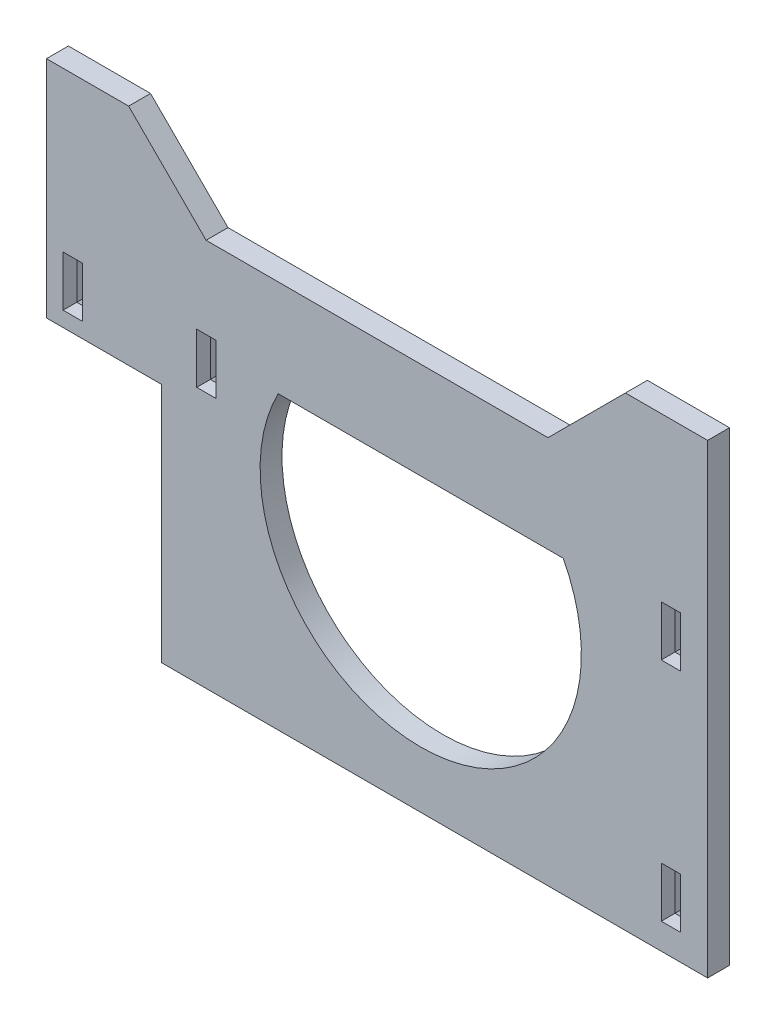
from build123d import *
from OCP.BRepFilletAPI import BRepFilletAPI_MakeChamfer

# Parameters (mm, degrees)
SKETCH1_W           = 3.53
SKETCH1_H           = 9.2
BOSS_EXTRUDE1_DEPTH = 4
BOSS_EXTRUDE2_DEPTH = 4
CHAMFER1_SIZE       = 1.5
CHAMFER1_SIZE2      = 0.5


with BuildPart() as part:
    # Sketch1 → Boss-Extrude1 (new body)
    with BuildSketch(Plane.XY):
        Polygon((52.4925, 30), (52.4925, -30), (-47.2075, -30), (-47.2075, 14), (-68.2075, 14), (-68.2075, 30), align=None)
        with BuildLine():
            Line((-25.900000003, 23.179137901), (26.135555553, 23.179137901))
            ThreePointArc((26.135555553, 23.179137901), (0.117777775, -19.676914391), (-25.900000003, 23.179137901))
        make_face(mode=Mode.SUBTRACT)
        with Locations((-39.0075, 21.35)):
            Rectangle(SKETCH1_W, SKETCH1_H, mode=Mode.SUBTRACT)
        with Locations((45.7925, 20.65)):
            Rectangle(SKETCH1_W, SKETCH1_H, mode=Mode.SUBTRACT)
        with Locations((45.8, -20.65)):
            Rectangle(SKETCH1_W, SKETCH1_H, mode=Mode.SUBTRACT)
        with Locations((-63.4075, 21.35)):
            Rectangle(SKETCH1_W, SKETCH1_H, mode=Mode.SUBTRACT)
    extrude(amount=BOSS_EXTRUDE1_DEPTH)

    # Sketch2 → Boss-Extrude2 (add)
    with BuildSketch(Plane.XY):
        Polygon((-68.2075, 30), (52.4925, 30), (52.4925, 55), (37.4925, 55), (23.350364376, 40.857864376), (-39.065364376, 40.857864376), (-53.2075, 55), (-68.2075, 55), align=None)
    extrude(amount=BOSS_EXTRUDE2_DEPTH)

    # Chamfer1: one chamfer whose edges measure the first distance from different faces: ONE call of the kernel's chamfer builder (chamfer() names one face for all edges)
    chamfer1_edges_1 = [part.edges().sort_by_distance(p)[0] for p in [
        (45.8, -25.25, 0),
    ]]
    chamfer1_side_1 = [part.faces().sort_by_distance(p)[0] for p in [
        (45.8, -25.25, 2),
    ]]
    chamfer1_edges_2 = [part.edges().sort_by_distance(p)[0] for p in [
        (44.035, -20.65, 0),
    ]]
    chamfer1_side_2 = [part.faces().sort_by_distance(p)[0] for p in [
        (44.035, -20.65, 2),
    ]]
    chamfer1_edges_3 = [part.edges().sort_by_distance(p)[0] for p in [
        (45.8, -16.05, 0),
    ]]
    chamfer1_side_3 = [part.faces().sort_by_distance(p)[0] for p in [
        (45.8, -16.05, 2),
    ]]
    chamfer1_edges_4 = [part.edges().sort_by_distance(p)[0] for p in [
        (47.565, -20.65, 0),
    ]]
    chamfer1_side_4 = [part.faces().sort_by_distance(p)[0] for p in [
        (47.565, -20.65, 2),
    ]]
    chamfer1_edges_5 = [part.edges().sort_by_distance(p)[0] for p in [
        (-63.4075, 25.95, 0),
    ]]
    chamfer1_side_5 = [part.faces().sort_by_distance(p)[0] for p in [
        (-63.4075, 25.95, 2),
    ]]
    chamfer1_edges_6 = [part.edges().sort_by_distance(p)[0] for p in [
        (-61.6425, 21.35, 0),
    ]]
    chamfer1_side_6 = [part.faces().sort_by_distance(p)[0] for p in [
        (-61.6425, 21.35, 2),
    ]]
    chamfer1_edges_7 = [part.edges().sort_by_distance(p)[0] for p in [
        (-63.4075, 16.75, 0),
    ]]
    chamfer1_side_7 = [part.faces().sort_by_distance(p)[0] for p in [
        (-63.4075, 16.75, 2),
    ]]
    chamfer1_edges_8 = [part.edges().sort_by_distance(p)[0] for p in [
        (-65.1725, 21.35, 0),
    ]]
    chamfer1_side_8 = [part.faces().sort_by_distance(p)[0] for p in [
        (-65.1725, 21.35, 2),
    ]]
    chamfer1_edges_9 = [part.edges().sort_by_distance(p)[0] for p in [
        (-39.0075, 25.95, 0),
    ]]
    chamfer1_side_9 = [part.faces().sort_by_distance(p)[0] for p in [
        (-39.0075, 25.95, 2),
    ]]
    chamfer1_edges_10 = [part.edges().sort_by_distance(p)[0] for p in [
        (-37.2425, 21.35, 0),
    ]]
    chamfer1_side_10 = [part.faces().sort_by_distance(p)[0] for p in [
        (-37.2425, 21.35, 2),
    ]]
    chamfer1_edges_11 = [part.edges().sort_by_distance(p)[0] for p in [
        (-39.0075, 16.75, 0),
    ]]
    chamfer1_side_11 = [part.faces().sort_by_distance(p)[0] for p in [
        (-39.0075, 16.75, 2),
    ]]
    chamfer1_edges_12 = [part.edges().sort_by_distance(p)[0] for p in [
        (-40.7725, 21.35, 0),
    ]]
    chamfer1_side_12 = [part.faces().sort_by_distance(p)[0] for p in [
        (-40.7725, 21.35, 2),
    ]]
    chamfer1_edges_13 = [part.edges().sort_by_distance(p)[0] for p in [
        (45.7925, 25.25, 0),
    ]]
    chamfer1_side_13 = [part.faces().sort_by_distance(p)[0] for p in [
        (45.7925, 25.25, 2),
    ]]
    chamfer1_edges_14 = [part.edges().sort_by_distance(p)[0] for p in [
        (47.5575, 20.65, 0),
    ]]
    chamfer1_side_14 = [part.faces().sort_by_distance(p)[0] for p in [
        (47.5575, 20.65, 2),
    ]]
    chamfer1_edges_15 = [part.edges().sort_by_distance(p)[0] for p in [
        (45.7925, 16.05, 0),
    ]]
    chamfer1_side_15 = [part.faces().sort_by_distance(p)[0] for p in [
        (45.7925, 16.05, 2),
    ]]
    chamfer1_edges_16 = [part.edges().sort_by_distance(p)[0] for p in [
        (44.0275, 20.65, 0),
    ]]
    chamfer1_side_16 = [part.faces().sort_by_distance(p)[0] for p in [
        (44.0275, 20.65, 2),
    ]]
    chamfer1 = BRepFilletAPI_MakeChamfer(part.part.solid().wrapped)
    for e in chamfer1_edges_1:
        chamfer1.Add(CHAMFER1_SIZE, CHAMFER1_SIZE2, e.wrapped, chamfer1_side_1[0].wrapped)  # the first distance lies on this face
    for e in chamfer1_edges_2:
        chamfer1.Add(CHAMFER1_SIZE, CHAMFER1_SIZE2, e.wrapped, chamfer1_side_2[0].wrapped)  # the first distance lies on this face
    for e in chamfer1_edges_3:
        chamfer1.Add(CHAMFER1_SIZE, CHAMFER1_SIZE2, e.wrapped, chamfer1_side_3[0].wrapped)  # the first distance lies on this face
    for e in chamfer1_edges_4:
        chamfer1.Add(CHAMFER1_SIZE, CHAMFER1_SIZE2, e.wrapped, chamfer1_side_4[0].wrapped)  # the first distance lies on this face
    for e in chamfer1_edges_5:
        chamfer1.Add(CHAMFER1_SIZE, CHAMFER1_SIZE2, e.wrapped, chamfer1_side_5[0].wrapped)  # the first distance lies on this face
    for e in chamfer1_edges_6:
        chamfer1.Add(CHAMFER1_SIZE, CHAMFER1_SIZE2, e.wrapped, chamfer1_side_6[0].wrapped)  # the first distance lies on this face
    for e in chamfer1_edges_7:
        chamfer1.Add(CHAMFER1_SIZE, CHAMFER1_SIZE2, e.wrapped, chamfer1_side_7[0].wrapped)  # the first distance lies on this face
    for e in chamfer1_edges_8:
        chamfer1.Add(CHAMFER1_SIZE, CHAMFER1_SIZE2, e.wrapped, chamfer1_side_8[0].wrapped)  # the first distance lies on this face
    for e in chamfer1_edges_9:
        chamfer1.Add(CHAMFER1_SIZE, CHAMFER1_SIZE2, e.wrapped, chamfer1_side_9[0].wrapped)  # the first distance lies on this face
    for e in chamfer1_edges_10:
        chamfer1.Add(CHAMFER1_SIZE, CHAMFER1_SIZE2, e.wrapped, chamfer1_side_10[0].wrapped)  # the first distance lies on this face
    for e in chamfer1_edges_11:
        chamfer1.Add(CHAMFER1_SIZE, CHAMFER1_SIZE2, e.wrapped, chamfer1_side_11[0].wrapped)  # the first distance lies on this face
    for e in chamfer1_edges_12:
        chamfer1.Add(CHAMFER1_SIZE, CHAMFER1_SIZE2, e.wrapped, chamfer1_side_12[0].wrapped)  # the first distance lies on this face
    for e in chamfer1_edges_13:
        chamfer1.Add(CHAMFER1_SIZE, CHAMFER1_SIZE2, e.wrapped, chamfer1_side_13[0].wrapped)  # the first distance lies on this face
    for e in chamfer1_edges_14:
        chamfer1.Add(CHAMFER1_SIZE, CHAMFER1_SIZE2, e.wrapped, chamfer1_side_14[0].wrapped)  # the first distance lies on this face
    for e in chamfer1_edges_15:
        chamfer1.Add(CHAMFER1_SIZE, CHAMFER1_SIZE2, e.wrapped, chamfer1_side_15[0].wrapped)  # the first distance lies on this face
    for e in chamfer1_edges_16:
        chamfer1.Add(CHAMFER1_SIZE, CHAMFER1_SIZE2, e.wrapped, chamfer1_side_16[0].wrapped)  # the first distance lies on this face
    add(Compound.cast(chamfer1.Shape()), mode=Mode.REPLACE)


solid = part.part
